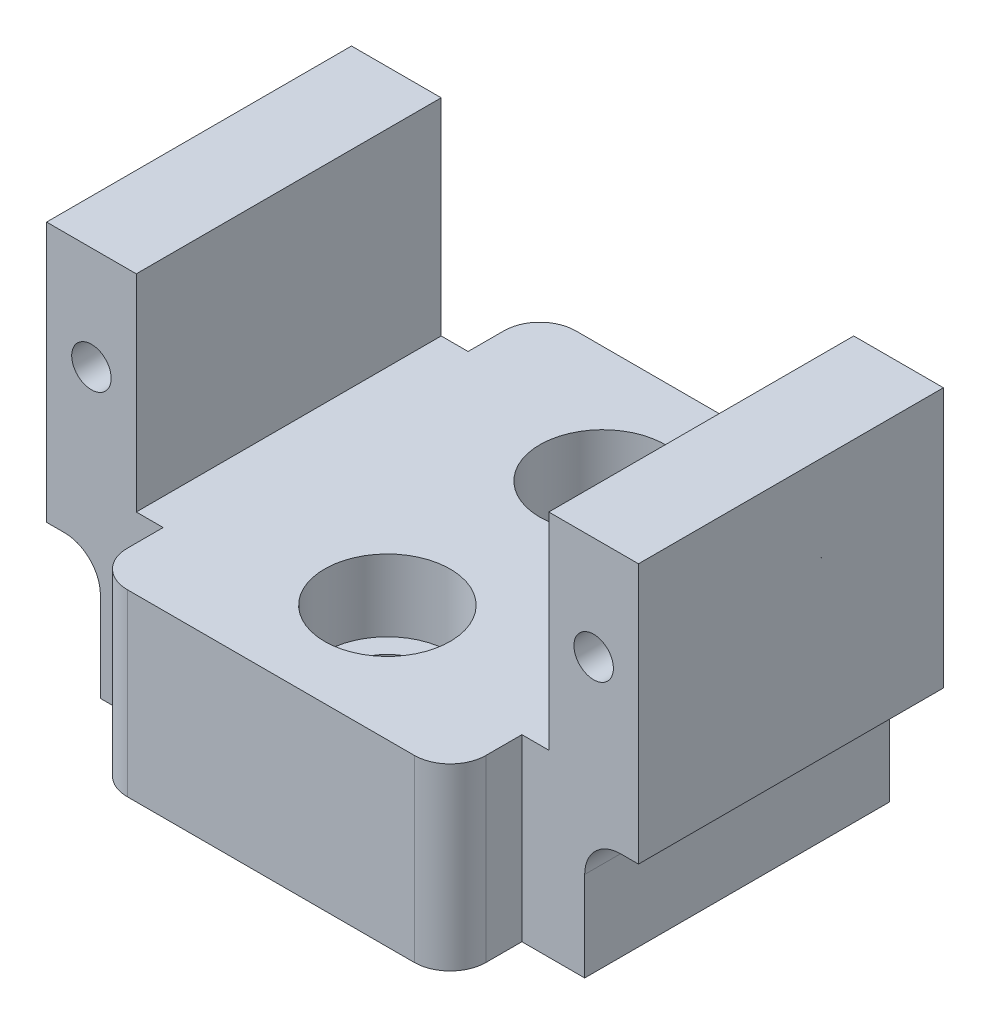
from build123d import *

# Parameters (mm, degrees)
SALIENTE_EXTRUIR1_DEPTH = 17
CROQUIS4_R              = 2.5
CORTAR_EXTRUIR2_DEPTH   = 5
CROQUIS5_W              = 27
CROQUIS5_H              = 17
CROQUIS5_R              = 2.5
SALIENTE_EXTRUIR4_DEPTH = 7
REDONDEO2_R             = 2
CROQUIS6_R              = 3.5
CORTAR_EXTRUIR3_DEPTH   = 1
CROQUIS9_R              = 3.5
SALIENTE_EXTRUIR7_DEPTH = 10
CROQUIS10_W             = 20
CROQUIS10_H             = 25
SALIENTE_EXTRUIR8_DEPTH = 10
CROQUIS11_R             = 2.3
CORTAR_EXTRUIR6_DEPTH   = 10
CROQUIS12_R             = 3.5
CORTAR_EXTRUIR7_DEPTH   = 4
REDONDEO3_R             = 2
CROQUIS8_R              = 1.1
CORTAR_EXTRUIR8_DEPTH   = 41.770700264


with BuildPart() as part:
    # Croquis2 → Saliente-Extruir1 (new body)
    with BuildSketch(Plane.XY):
        Polygon((0, 0), (0, 11.5), (5, 11.5), (5, 0), (28, 0), (28, 11.5), (33, 11.5), (33, 0), (33, -3), (0, -3), align=None)
    extrude(amount=SALIENTE_EXTRUIR1_DEPTH)

    # Croquis4 → Cortar-Extruir2 (cut)
    with BuildSketch(Plane(origin=(0, 0, 0), x_dir=(1, 0, 0), z_dir=(0, 1, 0))):
        with Locations((9, -8.5)):
            Circle(CROQUIS4_R)
        with Locations((24, -8.5)):
            Circle(CROQUIS4_R)
    extrude(amount=-CORTAR_EXTRUIR2_DEPTH, mode=Mode.SUBTRACT)

    # Croquis5 → Saliente-Extruir4 (add)
    with BuildSketch(Plane.XZ.offset(3)):
        with Locations((16.5, 8.5)):
            Rectangle(CROQUIS5_W, CROQUIS5_H)
        with Locations((9, 8.5)):
            Circle(CROQUIS5_R, mode=Mode.SUBTRACT)
        with Locations((24, 8.5)):
            Circle(CROQUIS5_R, mode=Mode.SUBTRACT)
    extrude(amount=SALIENTE_EXTRUIR4_DEPTH)

    # Redondeo2
    redondeo2_edges = [part.edges().sort_by_distance(p)[0] for p in [
        (3, -3, 8.5),
        (30, -3, 8.5),
    ]]
    fillet(redondeo2_edges, radius=REDONDEO2_R)

    # Croquis6 → Cortar-Extruir3 (cut)
    with BuildSketch(Plane(origin=(0, 0, 0), x_dir=(1, 0, 0), z_dir=(0, 1, 0))):
        with Locations((9, -8.5)):
            Circle(CROQUIS6_R)
        with Locations((24, -8.5)):
            Circle(CROQUIS6_R)
    extrude(amount=-CORTAR_EXTRUIR3_DEPTH, mode=Mode.SUBTRACT)

    # Croquis9 → Saliente-Extruir7 (add)
    with BuildSketch(Plane(origin=(0, 0, 0), x_dir=(1, 0, 0), z_dir=(0, 1, 0))):
        with Locations((9, -8.5)):
            Circle(CROQUIS9_R)
        with Locations((24, -8.5)):
            Circle(CROQUIS9_R)
    extrude(amount=-SALIENTE_EXTRUIR7_DEPTH)

    # Croquis10 → Saliente-Extruir8 (add)
    with BuildSketch(Plane.XZ.offset(10)):
        with Locations((16.5, 8.5)):
            Rectangle(CROQUIS10_W, CROQUIS10_H)
    extrude(amount=-SALIENTE_EXTRUIR8_DEPTH)

    # Croquis11 → Cortar-Extruir6 (cut)
    with BuildSketch(Plane.XZ.offset(10)):
        with Locations((16.5, 14.5)):
            Circle(CROQUIS11_R)
        with Locations((16.5, 2.5)):
            Circle(CROQUIS11_R)
    extrude(amount=-CORTAR_EXTRUIR6_DEPTH, mode=Mode.SUBTRACT)

    # Croquis12 → Cortar-Extruir7 (cut)
    with BuildSketch(Plane(origin=(0, 0, 0), x_dir=(1, 0, 0), z_dir=(0, 1, 0))):
        with Locations((16.5, -2.5)):
            Circle(CROQUIS12_R)
        with Locations((16.5, -14.5)):
            Circle(CROQUIS12_R)
    extrude(amount=-CORTAR_EXTRUIR7_DEPTH, mode=Mode.SUBTRACT)

    # Redondeo3
    redondeo3_edges = [part.edges().sort_by_distance(p)[0] for p in [
        (26.5, -5, -4),
        (6.5, -5, -4),
        (6.5, -5, 21),
        (26.5, -5, 21),
    ]]
    fillet(redondeo3_edges, radius=REDONDEO3_R)

    # Croquis8 → Cortar-Extruir8 (cut, through all)
    with BuildSketch(Plane.XY.offset(17)):
        with Locations((2.5, 5.75)):
            Circle(CROQUIS8_R)
        with Locations((30.5, 5.75)):
            Circle(CROQUIS8_R)
    extrude(amount=-CORTAR_EXTRUIR8_DEPTH, mode=Mode.SUBTRACT)


solid = part.part
